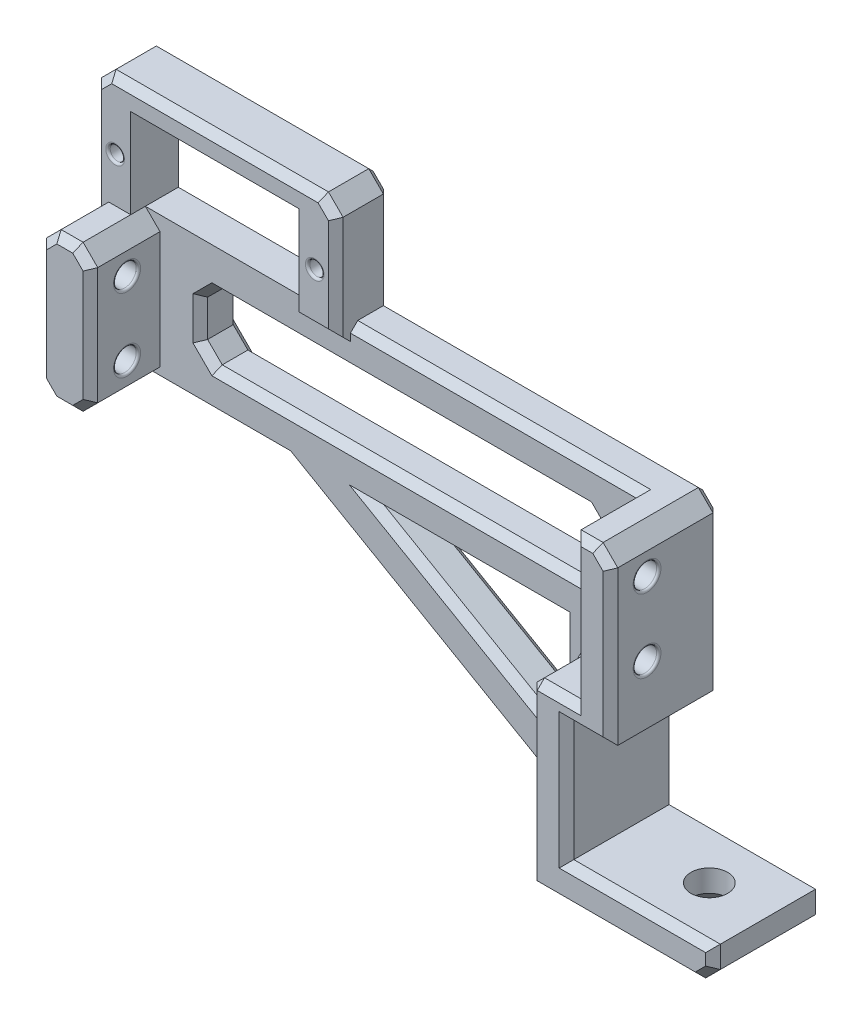
from build123d import *

# Parameters (mm, degrees)
RESSALTO_EXTRUS_O1_DEPTH  = 7.5
ESBO_O2_W                 = 33
ESBO_O2_H                 = 18.2
ESBO_O2_R                 = 0.975
ESBO_O2_W_2               = 23
ESBO_O2_H_2               = 12.2
RESSALTO_EXTRUS_O2_DEPTH  = 3
ESBO_O3_R                 = 0.975
RESSALTO_EXTRUS_O3_DEPTH  = 6
RESSALTO_EXTRUS_O4_DEPTH  = 1.5
ESBO_O6_R                 = 2.5
CORTE_EXTRUS_O1_DEPTH     = 9.5
CHANFRO1_SIZE             = 2
ESBO_O7_W                 = 15
ESBO_O7_H                 = 20
ESBO_O7_R                 = 1.6
RESSALTO_EXTRUS_O5_DEPTH  = 5
ESBO_O9_W                 = 12
ESBO_O9_H                 = 20
RESSALTO_EXTRUS_O6_DEPTH  = 2
ESBO_O10_W                = 12
ESBO_O10_H                = 20
ESBO_O10_R                = 1.55
RESSALTO_EXTRUS_O7_DEPTH  = 5
ESBO_O12_W                = 3
ESBO_O12_H                = 20
RESSALTO_EXTRUS_O11_DEPTH = 73
ESBO_O17_W                = 26
ESBO_O17_H                = 3
CORTE_EXTRUS_O2_DEPTH     = 4.5
ESBO_O18_R                = 0.975
RESSALTO_EXTRUS_O14_DEPTH = 4.5
ESBO_O19_W                = 55
ESBO_O19_H                = 9
CORTE_EXTRUS_O3_DEPTH     = 10
CHANFRO5_SIZE             = 2
RESSALTO_EXTRUS_O15_DEPTH = 3
RESSALTO_EXTRUS_O16_DEPTH = 2.5
CHANFRO8_SIZE             = 2
CHANFRO9_SIZE             = 2
CHANFRO10_SIZE            = 1
CHANFRO11_SIZE            = 1
FILETE1_R                 = 0.3


with BuildPart() as part:
    # Esboço1 → Ressalto-extrusão1 (new, symmetric)
    with BuildSketch(Plane.XY):
        Polygon((0, 0), (-6, 0), (-6, -16.5), (14, -16.5), (14, -21.5), (-11, -21.5), (-11, 3), (0, 3), align=None)
    extrude(amount=RESSALTO_EXTRUS_O1_DEPTH, both=True)

    # Esboço6 → Corte-extrusão1 (cut)
    with BuildSketch(Plane.XZ.offset(21.5)):
        with Locations((6, 0)):
            Circle(ESBO_O6_R)
    extrude(amount=-CORTE_EXTRUS_O1_DEPTH, mode=Mode.SUBTRACT)

    # Chanfro1
    chanfro1_edges = [part.edges().sort_by_distance(p)[0] for p in [
        (3.5, -21.5, 0),
    ]]
    chamfer(chanfro1_edges, length=CHANFRO1_SIZE)

    # Esboço7 → Ressalto-extrusão5 (add)
    with BuildSketch(Plane(origin=(0, 0, 0), x_dir=(0, 0, -1), z_dir=(1, 0, 0))):
        with Locations((0, 13)):
            Rectangle(ESBO_O7_W, ESBO_O7_H)
        with Locations(Location((-2.5, 18, 0), (0, 0, 90))):
            Circle(ESBO_O7_R, mode=Mode.SUBTRACT)
        with Locations(Location((-2.5, 8, 0), (0, 0, 90))):
            Circle(ESBO_O7_R, mode=Mode.SUBTRACT)
    extrude(amount=-RESSALTO_EXTRUS_O5_DEPTH)



with BuildPart() as body_2:
    # Esboço2 → Ressalto-extrusão2 (new body)
    with BuildSketch(Plane.XY.offset(-3)):
        with Locations((-61.5, 29.1)):
            Rectangle(ESBO_O2_W, ESBO_O2_H)
        with Locations((-75.125, 29.1)):
            Circle(ESBO_O2_R, mode=Mode.SUBTRACT)
        with Locations((-47.875, 29.1)):
            Circle(ESBO_O2_R, mode=Mode.SUBTRACT)
        with Locations((-61.5, 29.1)):
            Rectangle(ESBO_O2_W_2, ESBO_O2_H_2, mode=Mode.SUBTRACT)
    extrude(amount=RESSALTO_EXTRUS_O2_DEPTH)

    # Esboço3 → Ressalto-extrusão3 (add)
    # profile 1 of 2: a face of its own
    with BuildSketch(Plane.XY):
        Polygon((-75.125, 31.553738644), (-77.25, 30.326869322), (-77.25, 27.873130678), (-75.125, 26.646261356), (-73, 27.873130678), (-73, 30.326869322), align=None)
        with Locations((-75.125, 29.1)):
            Circle(ESBO_O3_R, mode=Mode.SUBTRACT)
    # profile 2 of 2: a face of its own
    with BuildSketch(Plane.XY):
        Polygon((-47.875, 31.553738644), (-50, 30.326869322), (-50, 27.873130678), (-47.875, 26.646261356), (-45.75, 27.873130678), (-45.75, 30.326869322), align=None)
        with Locations((-47.875, 29.1)):
            Circle(ESBO_O3_R, mode=Mode.SUBTRACT)
    extrude(amount=-RESSALTO_EXTRUS_O3_DEPTH)

    # Esboço4 → Ressalto-extrusão4 (add)
    with BuildSketch(Plane(origin=(0, 0, -6), x_dir=(-1, 0, 0), z_dir=(0, 0, -1))):
        Polygon((47.875, 31.553738644), (45.75, 30.326869322), (45.75, 27.873130678), (47.875, 26.646261356), (50, 27.873130678), (50, 30.326869322), align=None)
        Polygon((75.125, 31.553738644), (73, 30.326869322), (73, 27.873130678), (75.125, 26.646261356), (77.25, 27.873130678), (77.25, 30.326869322), align=None)
    extrude(amount=RESSALTO_EXTRUS_O4_DEPTH)

    # Esboço9 → Ressalto-extrusão6 (add)
    with BuildSketch(Plane(origin=(-78, 0, 0), x_dir=(0, 0, -1), z_dir=(1, 0, 0))):
        with Locations((-1.5, 13)):
            Rectangle(ESBO_O9_W, ESBO_O9_H)
    extrude(amount=RESSALTO_EXTRUS_O6_DEPTH)

    # Esboço10 → Ressalto-extrusão7 (add)
    with BuildSketch(Plane(origin=(-76, 0, 0), x_dir=(0, 0, -1), z_dir=(1, 0, 0))):
        with Locations((-1.5, 13)):
            Rectangle(ESBO_O10_W, ESBO_O10_H)
        with Locations((-2.5, 18)):
            Circle(ESBO_O10_R, mode=Mode.SUBTRACT)
        with Locations((-2.5, 8)):
            Circle(ESBO_O10_R, mode=Mode.SUBTRACT)
    extrude(amount=RESSALTO_EXTRUS_O7_DEPTH)


with BuildPart() as part_1:
    add(part.part)

    add(body_2.part)  # Ressalto-extrusão11 merges body 2
    # Esboço12 → Ressalto-extrusão11 (add)
    with BuildSketch(Plane(origin=(-78, 0, 0), x_dir=(0, 0, -1), z_dir=(1, 0, 0))):
        with Locations((6, 13)):
            Rectangle(ESBO_O12_W, ESBO_O12_H)
    extrude(amount=RESSALTO_EXTRUS_O11_DEPTH)

    # Esboço17 → Corte-extrusão2 (cut)
    with BuildSketch(Plane.XY):
        with Locations((-58, 21.5)):
            Rectangle(ESBO_O17_W, ESBO_O17_H)
    extrude(amount=-CORTE_EXTRUS_O2_DEPTH, mode=Mode.SUBTRACT)

    # Esboço18 → Ressalto-extrusão14 (add)
    with BuildSketch(Plane(origin=(0, 0, -3), x_dir=(-1, 0, 0), z_dir=(0, 0, -1))):
        Polygon((45, 38.2), (45, 23), (50, 23), (50, 30.326869322), (50, 35.2), (73, 35.2), (73, 30.326869322), (73, 23), (78, 23), (78, 38.2), align=None)
        with Locations(Location((75.125, 29.1, 0), (0, 0, 180))):
            Circle(ESBO_O18_R, mode=Mode.SUBTRACT)
        with Locations(Location((47.875, 29.1, 0), (0, 0, 180))):
            Circle(ESBO_O18_R, mode=Mode.SUBTRACT)
    extrude(amount=RESSALTO_EXTRUS_O14_DEPTH)

    # Esboço19 → Corte-extrusão3 (cut)
    with BuildSketch(Plane.XY.offset(-4.5)):
        with Locations((-38, 13)):
            Rectangle(ESBO_O19_W, ESBO_O19_H)
    extrude(amount=-CORTE_EXTRUS_O3_DEPTH, mode=Mode.SUBTRACT)

    # Chanfro5
    chanfro5_edges = [part_1.edges().sort_by_distance(p)[0] for p in [
        (-65.5, 17.5, -6),
        (-10.5, 17.5, -6),
        (-10.5, 8.5, -6),
        (-65.5, 8.5, -6),
    ]]
    chamfer(chanfro5_edges, length=CHANFRO5_SIZE)

    # Esboço20 → Ressalto-extrusão15 (add)
    with BuildSketch(Plane(origin=(0, 0, -7.5), x_dir=(-1, 0, 0), z_dir=(0, 0, -1))):
        Polygon((11, -21.5), (53.435244785, 3), (41.435244785, 3), (16, -11.685045424), (16, 3), (11, 3), align=None)
    extrude(amount=-RESSALTO_EXTRUS_O15_DEPTH)

    # Esboço21 → Ressalto-extrusão16 (add)
    with BuildSketch(Plane.XY.offset(-4.5)):
        Polygon((-5, 23), (-45, 23), (-50, 23), (-71, 23), (-71, 3), (-53.435244785, 3), (-11, -21.5), (-11, 3), (-5, 3), align=None)
        Polygon((-16, -11.685045424), (-16, 3), (-41.435244785, 3), align=None, mode=Mode.SUBTRACT)
        Polygon((-12.5, 17.5), (-10.5, 15.5), (-10.5, 10.5), (-12.5, 8.5), (-63.5, 8.5), (-65.5, 10.5), (-65.5, 15.5), (-63.5, 17.5), align=None, mode=Mode.SUBTRACT)
    extrude(amount=RESSALTO_EXTRUS_O16_DEPTH)

    # Chanfro8
    chanfro8_edges = [part_1.edges().sort_by_distance(p)[0] for p in [
        (-47.5, 23, -2),
        (-8, 3, -2),
    ]]
    chamfer(chanfro8_edges, length=CHANFRO8_SIZE - 0.0001)  # a hair under: the kernel refuses the full size

    # Chanfro9
    chanfro9_edges = [part_1.edges().sort_by_distance(p)[0] for p in [
        (14, -21.5, 0),
        (-71, 23, 2.75),
        (0, 23, 0),
        (-78, 3, 0),
        (-78, 23, 3.75),
        (-78, 38.2, -3.75),
        (-45, 38.2, -3.75),
        (-71, 3, 2.75),
    ]]
    chamfer(chanfro9_edges, length=CHANFRO9_SIZE - 0.0001)  # a hair under: the kernel refuses the full size

    # Chanfro10
    chanfro10_edges = [part_1.edges().sort_by_distance(p)[0] for p in [
        (0.50005, -21.5, -7.5),
        (0, 10.50005, -7.5),
        (-45, 29.60005, 0),
        (-11, -9.25, 7.5),
        (-61.5, 23, -7.5),
        (-11, 3, 3.74995),
        (-23.49995, 23, -7.5),
        (-61.5, 35.2, -7.5),
        (0.50005, -21.5, 7.5),
        (-38, 8.5, -7.5),
        (-65.5, 13, -7.5),
        (-38, 17.5, -7.5),
        (-10.5, 13, -7.5),
        (-64.5, 9.5, -7.5),
        (-64.5, 16.5, -7.5),
        (-11.5, 9.5, -7.5),
        (-11.5, 16.5, -7.5),
        (4, -16.5, 7.5),
        (-28.717622393, 3, -7.5),
        (-64.717672393, 3, -7.5),
        (-32.217622393, -9.25, -7.5),
        (-28.717622393, -4.342522712, -7.5),
        (-16, -4.342522712, -7.5),
        (-25, 23, -2),
        (-63.217572393, 3, -2),
        (-32.217622393, -9.25, -2),
        (-6, -8.25, 7.5),
        (-28.717622393, -4.342522712, -2),
        (-16, -4.342522712, -2),
        (-28.717622393, 3, -2),
        (-38, 17.5, -2),
        (-64.5, 16.5, -2),
        (-65.5, 13, -2),
        (-64.5, 9.5, -2),
        (-38, 8.5, -2),
        (-11.5, 9.5, -2),
        (-10.5, 13, -2),
        (-11.5, 16.5, -2),
        (-3, 0, 7.5),
        (-8, 3, 7.5),
        (-5, 13, 7.5),
        (-78, 20.6, -7.5),
        (-78, 13, 7.5),
        (-78, 28.6001, 0),
        (-3.49995, 23, 7.5),
        (-61.5, 38.2, -7.5),
        (-45, 29.60005, -7.5),
        (14, -18.00005, -7.5),
        (-0.99995, 22.00005, -7.5),
        (13.00005, -20.50005, -7.5),
        (-77.00005, 3.99995, -7.5),
        (-45.99995, 37.20005, -7.5),
        (-77.00005, 37.20005, -7.5),
        (-61.5, 38.2, 0),
        (-45.99995, 37.20005, 0),
        (-77.00005, 37.20005, 0),
        (-71, 13, 7.5),
        (-74.5, 3, 7.5),
        (-74.5, 23, 7.5),
        (-77.00005, 22.00005, 7.5),
        (-71.99995, 22.00005, 7.5),
        (-77.00005, 3.99995, 7.5),
        (-71.99995, 3.99995, 7.5),
        (14, -18.00005, 7.5),
        (-0.99995, 22.00005, 7.5),
        (13.00005, -20.50005, 7.5),
        (0, 10.50005, 7.5),
        (-73, 29.1, -7.5),
        (-50, 29.1, -7.5),
        (-3, 0, -7.5),
        (-6, -8.25, -7.5),
        (4, -16.5, -7.5),
    ]]
    chamfer(chanfro10_edges, length=CHANFRO10_SIZE)

    # Chanfro11
    chanfro11_edges = [part_1.edges().sort_by_distance(p)[0] for p in [
        (-11, -21.5, 1.75),
    ]]
    chamfer(chanfro11_edges, length=CHANFRO11_SIZE)

    # Filete1
    filete1_edges = [part_1.edges().sort_by_distance(p)[0] for p in [
        (-5, 16.4, 2.5),
        (-5, 6.4, 2.5),
        (0, 6.4, 2.5),
        (0, 16.4, 2.5),
        (-76.1, 29.1, 0),
        (-48.85, 29.1, 0),
        (-71, 18, 4.05),
        (-71, 8, 4.05),
    ]]
    fillet(filete1_edges, radius=FILETE1_R)


solid = part_1.part
